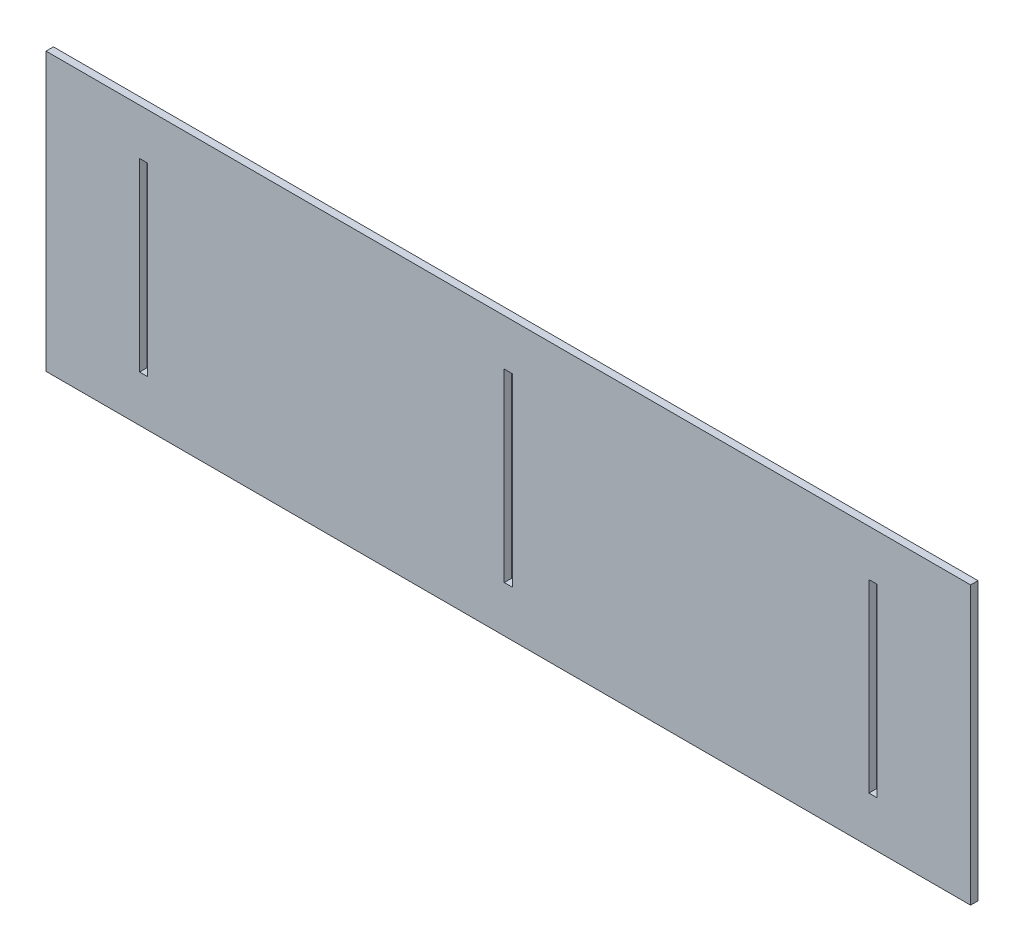
from build123d import *

# Parameters (mm, degrees)
SKETCH_2_W               = 250
SKETCH_2_H               = 75
EXTRUDE_3_DEPTH          = 2
CUT_EXTRUDE_1_DEPTH      = 2
CUT_EXTRUDE_1_DEPTH_BACK = 2
SKETCH_4_W               = 2.2
SKETCH_4_H               = 50


with BuildPart() as part:
    # 草图2 → 凸台-拉伸3 (new body)
    with BuildSketch(Plane.XY):
        with Locations((51.318241286, 40.884671024)):
            Rectangle(SKETCH_2_W, SKETCH_2_H)
    extrude(amount=EXTRUDE_3_DEPTH)

    # 草图4 → 切除-拉伸1 (cut, two sides: drawn at the far end of the back side and taken through both)
    with BuildSketch(Plane.XY.offset(-CUT_EXTRUDE_1_DEPTH_BACK)):
        with Locations((149.918241286, 40.884671024)):
            Rectangle(SKETCH_4_W, SKETCH_4_H)
        with Locations((-47.281758714, 40.884671024)):
            Rectangle(SKETCH_4_W, SKETCH_4_H)
        with Locations((51.318241286, 40.884671024)):
            Rectangle(SKETCH_4_W, SKETCH_4_H)
    extrude(amount=CUT_EXTRUDE_1_DEPTH + CUT_EXTRUDE_1_DEPTH_BACK, mode=Mode.SUBTRACT)


solid = part.part
